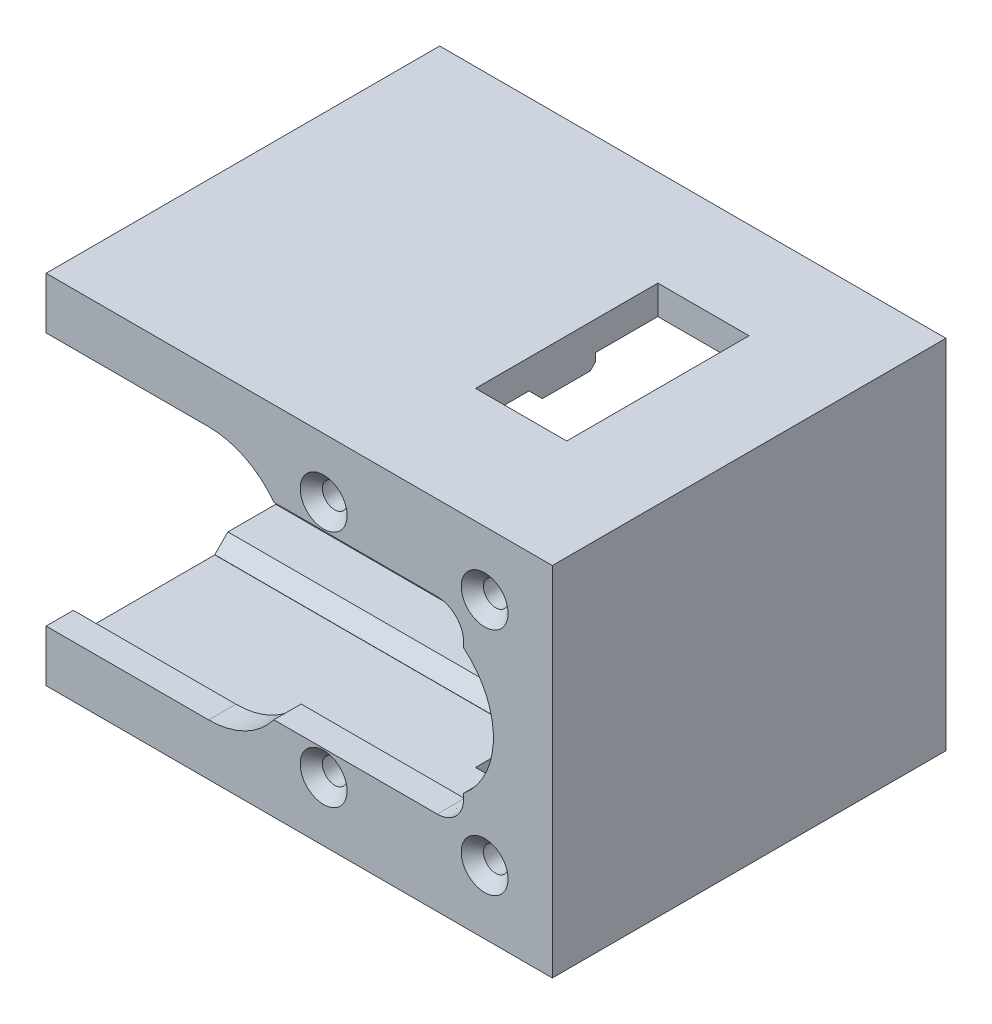
from build123d import *

# Parameters (mm, degrees)
BOSS_EXTRUDE1_START = 0.1
BOSS_EXTRUDE1_DEPTH = 3.2
BOSS_EXTRUDE4_DEPTH = 43
MIRROR9_START       = -12.580412483
MIRROR9_DEPTH       = 56.024226278
CUT_EXTRUDE1_START  = -41.930024
SKETCH5_W           = 10.7
SKETCH5_H           = 21.400046012
CUT_EXTRUDE1_DEPTH  = 41.930024


with BuildPart() as part:
    # Sketch1 → Boss-Extrude1 (new body)
    with BuildSketch(Plane.XY.offset(BOSS_EXTRUDE1_START)):
        with BuildLine():
            Line((6.5, -20.96501071), (40.371666845, -20.96501071))
            Line((40.371666845, -20.96501071), (46.843813692, -20.96501071))
            Line((46.843813692, -20.96501071), (46.843813692, -14.492829244))
            Line((46.843813692, -14.492829244), (46.843817152, 14.492909287))
            Line((46.843817152, 14.492909287), (46.843817152, 20.965012858))
            Line((46.843817152, 20.965012858), (40.371232335, 20.965012858))
            Line((40.371232335, 20.965012858), (-12.580412483, 20.965012858))
            Line((-12.580412483, 20.965012858), (-12.580412483, 14.9))
            Line((-12.580412483, 14.9), (6.5, 14.9))
            ThreePointArc((6.5, 14.9), (10.784081461, 13.885171119), (14.157668767, 11.056365661))
            Line((14.157668767, 11.056365661), (33.335287122, 11.056365661))
            add(Edge.make_bspline(
                [(33.335287122, 11.056365661), (33.738464028, 11.056365661), (34.553650563, 10.895055506), (35.583998517, 10.205191286), (36.273862737, 9.174843333), (36.435172892, 8.359656798), (36.435172892, 7.956479892)],
                knots=[-0.785360087, -0.785360087, -0.785360087, -0.785360087, -0.392680044, 0, 0.392680044, 0.785360087, 0.785360087, 0.785360087, 0.785360087], degree=3))
            Line((36.435172892, 7.956479892), (36.435172892, 7.38396472))
            ThreePointArc((36.435172892, 7.38396472), (39.928807231, 0), (36.435172892, -7.38396472))
            Line((36.435172892, -7.38396472), (36.435172892, -7.956479892))
            add(Edge.make_bspline(
                [(36.435172892, -7.956479892), (36.435172892, -8.359656798), (36.273862737, -9.174843333), (35.583998517, -10.205191286), (34.553650563, -10.895055506), (33.738464028, -11.056365661), (33.335287122, -11.056365661)],
                knots=[-0.785360087, -0.785360087, -0.785360087, -0.785360087, -0.392680044, 0, 0.392680044, 0.785360087, 0.785360087, 0.785360087, 0.785360087], degree=3))
            Line((33.335287122, -11.056365661), (14.157668767, -11.056365661))
            ThreePointArc((14.157668767, -11.056365661), (10.784081461, -13.885171119), (6.5, -14.9))
            Line((6.5, -14.9), (-12.580412483, -14.9))
            Line((-12.580412483, -14.9), (-12.580412483, -20.96501071))
            Line((-12.580412483, -20.96501071), (6.5, -20.96501071))
        make_face()
    extrude(amount=BOSS_EXTRUDE1_DEPTH)


with BuildPart() as body_2:
    # Mirror8: mirrored copy
    add(part.part.mirror(Plane.XY.offset(-19.8)))


with BuildPart() as part_1:
    add(part.part)

    add(body_2.part)  # Boss-Extrude4 merges body 2
    # Sketch3 → Boss-Extrude4 (add)
    with BuildSketch(Plane(origin=(0, 0, 0.1), x_dir=(-1, 0, 0), z_dir=(0, 0, -1))):
        with BuildLine():
            Line((-46.843817152, -20.96501071), (12.580412483, -20.96501071))
            Line((12.580412483, -20.96501071), (12.580412481, -17.56501071))
            Line((12.580412481, -17.56501071), (-40.344731515, -17.565009918))
            add(Edge.make_bspline(
                [(-40.344731515, -17.565009918), (-40.442934479, -17.56345098), (-40.546251638, -17.560214099), (-40.748160222, -17.540082036), (-40.848537497, -17.525369256), (-41.147208229, -17.466024859), (-41.34230873, -17.40685234), (-41.904876795, -17.173936033), (-42.248881792, -16.944079436), (-42.822875895, -16.370055351), (-43.052718695, -16.026081256), (-43.285678392, -15.463505278), (-43.344823049, -15.268405947), (-43.404196351, -14.969745759), (-43.418915361, -14.869354632), (-43.439033339, -14.667434906), (-43.442259272, -14.564125008), (-43.443813695, -14.465921992)],
                knots=[0, 0, 0, 0, 0.0625, 0.0625, 0.125, 0.125, 0.25, 0.25, 0.5, 0.5, 0.75, 0.75, 0.875, 0.875, 0.9375, 0.9375, 1, 1, 1, 1], degree=3))
            Line((-43.443813695, -14.465921992), (-43.443817149, 14.465924278))
            add(Edge.make_bspline(
                [(-43.443817149, 14.465924278), (-43.442258211, 14.564127242), (-43.43902133, 14.6674444), (-43.418889268, 14.869352985), (-43.404176488, 14.969730261), (-43.344832091, 15.268400993), (-43.285659572, 15.463501494), (-43.052743266, 16.026069561), (-42.822886669, 16.370074559), (-42.248862584, 16.944068663), (-41.904888488, 17.173911463), (-41.342312509, 17.406871161), (-41.147213178, 17.466015819), (-40.84855299, 17.52538912), (-40.748161863, 17.54010813), (-40.546242137, 17.560226109), (-40.442932239, 17.563452042), (-40.344729223, 17.565006465)],
                knots=[0, 0, 0, 0, 0.0625, 0.0625, 0.125, 0.125, 0.25, 0.25, 0.5, 0.5, 0.75, 0.75, 0.875, 0.875, 0.9375, 0.9375, 1, 1, 1, 1], degree=3))
            Line((-40.344729223, 17.565006465), (12.580412471, 17.565012858))
            Line((12.580412471, 17.565012858), (12.580412483, 20.965012858))
            Line((12.580412483, 20.965012858), (-46.843817152, 20.965012858))
            Line((-46.843817152, 20.965012858), (-46.843817152, -20.96501071))
        make_face()
    extrude(amount=BOSS_EXTRUDE4_DEPTH)


with BuildPart() as mirror9_tool:
    # Mirror9: read off the stored shape, not the designer's step
    # Mirror9 outline → Mirror9 (new body)
    with BuildSketch(Plane.YZ.offset(MIRROR9_START)):
        Polygon((17.541421356, -16.5), (16, -18.041421356), (16, -23.658578644), (16.641421356, -24.3), (17.565009661, -24.3), (17.565007122, -16.5), align=None)
        Polygon((-17.56501071, -24.3), (-16.641421356, -24.3), (-16, -23.658578644), (-16, -18.041421356), (-17.541421356, -16.5), (-17.56501071, -16.5), align=None)
    extrude(amount=MIRROR9_DEPTH)


with BuildPart() as part_2:
    add(part_1.part)


with BuildPart() as part_3:
    # Mirror9: joined with mirror9_tool
    add(part_2.part.fuse(mirror9_tool.part, tol=0.00001))

    # Sketch5 → Cut-Extrude1 (cut)
    with BuildSketch(Plane(origin=(0, 20.965012858, 0), x_dir=(1, 0, 0), z_dir=(0, 1, 0)).offset(CUT_EXTRUDE1_START)):
        with Locations((29.678807231, 20.899976994)):
            Rectangle(SKETCH5_W, SKETCH5_H)
    extrude(amount=CUT_EXTRUDE1_DEPTH, mode=Mode.SUBTRACT)

    # CSK for M2.5 Countersunk Flat Head Screw1: read off the stored shape, not the designer's step
    # CSK for M2.5 Countersunk Flat Head S 2 → CSK for M2.5 Countersunk Flat Head Screw1 (revolve, cut)
    with BuildSketch(Plane(origin=(20, -14, 0), x_dir=(1, 0, 0), z_dir=(0, -1, 0))):
        Polygon((1.45, -41.6), (1.45, -39.7), (0, -39.7), (0, -42.9), (2.75, -42.9), align=None)
        Polygon((0, 0.1), (1.45, 0.1), (1.45, 2), (2.75, 3.3), (0, 3.3), align=None)
    revolve(axis=Axis((20, -14, 0), (0, 0, 1)), mode=Mode.SUBTRACT)

    # CSK for M2.5 Countersunk Flat Head S 3 o → CSK for M2.5 Countersunk Flat Head S 3 (revolve, cut)
    with BuildSketch(Plane(origin=(20, 14, 0), x_dir=(1, 0, 0), z_dir=(0, -1, 0))):
        Polygon((1.45, -41.6), (1.45, -39.7), (0, -39.7), (0, -42.9), (2.75, -42.9), align=None)
        Polygon((0, 0.1), (1.45, 0.1), (1.45, 2), (2.75, 3.3), (0, 3.3), align=None)
    revolve(axis=Axis((20, 14, 0), (0, 0, 1)), mode=Mode.SUBTRACT)

    # CSK for M2.5 Countersunk Flat Head S 4 o → CSK for M2.5 Countersunk Flat Head S 4 (revolve, cut)
    with BuildSketch(Plane(origin=(38.9, 13.5, 0), x_dir=(1, 0, 0), z_dir=(0, -1, 0))):
        Polygon((1.45, -41.6), (1.45, -39.7), (0, -39.7), (0, -42.9), (2.75, -42.9), align=None)
        Polygon((0, 0.1), (1.45, 0.1), (1.45, 2), (2.75, 3.3), (0, 3.3), align=None)
    revolve(axis=Axis((38.9, 13.5, 0), (0, 0, 1)), mode=Mode.SUBTRACT)

    # CSK for M2.5 Countersunk Flat Head S 5 o → CSK for M2.5 Countersunk Flat Head S 5 (revolve, cut)
    with BuildSketch(Plane(origin=(38.9, -13.5, 0), x_dir=(1, 0, 0), z_dir=(0, -1, 0))):
        Polygon((1.45, -41.6), (1.45, -39.7), (0, -39.7), (0, -42.9), (2.75, -42.9), align=None)
        Polygon((0, 0.1), (1.45, 0.1), (1.45, 2), (2.75, 3.3), (0, 3.3), align=None)
    revolve(axis=Axis((38.9, -13.5, 0), (0, 0, 1)), mode=Mode.SUBTRACT)


solid = part_3.part
